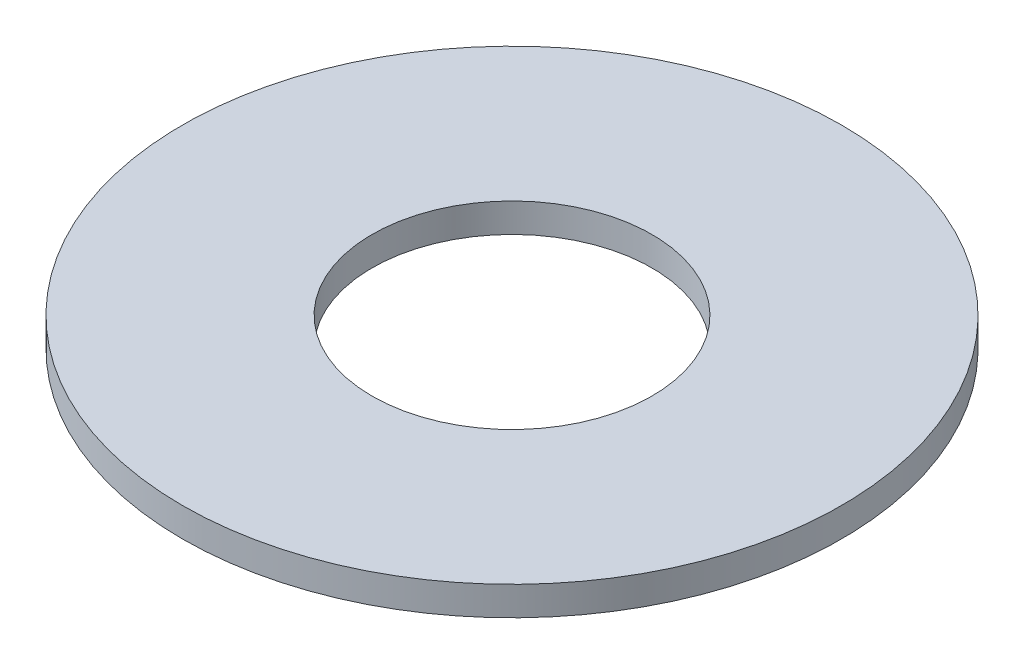
from build123d import *

# Parameters (mm, degrees)
SKETCH1_R           = 15.875
BOSS_EXTRUDE1_DEPTH = 1.397
SKETCH5_R           = 6.7437
CUT_EXTRUDE1_DEPTH  = 23.49406275


with BuildPart() as part:
    # Sketch1 → Boss-Extrude1 (new body)
    with BuildSketch(Plane(origin=(0, 0, 0), x_dir=(1, 0, 0), z_dir=(0, 1, 0))):
        Circle(SKETCH1_R)
    extrude(amount=BOSS_EXTRUDE1_DEPTH)

    # Sketch5 → Cut-Extrude1 (cut, through all)
    with BuildSketch(Plane(origin=(0, 1.397, 0), x_dir=(-1, 0, 0), z_dir=(0, 1, 0))):
        Circle(SKETCH5_R)
    extrude(amount=-CUT_EXTRUDE1_DEPTH, mode=Mode.SUBTRACT)


solid = part.part
